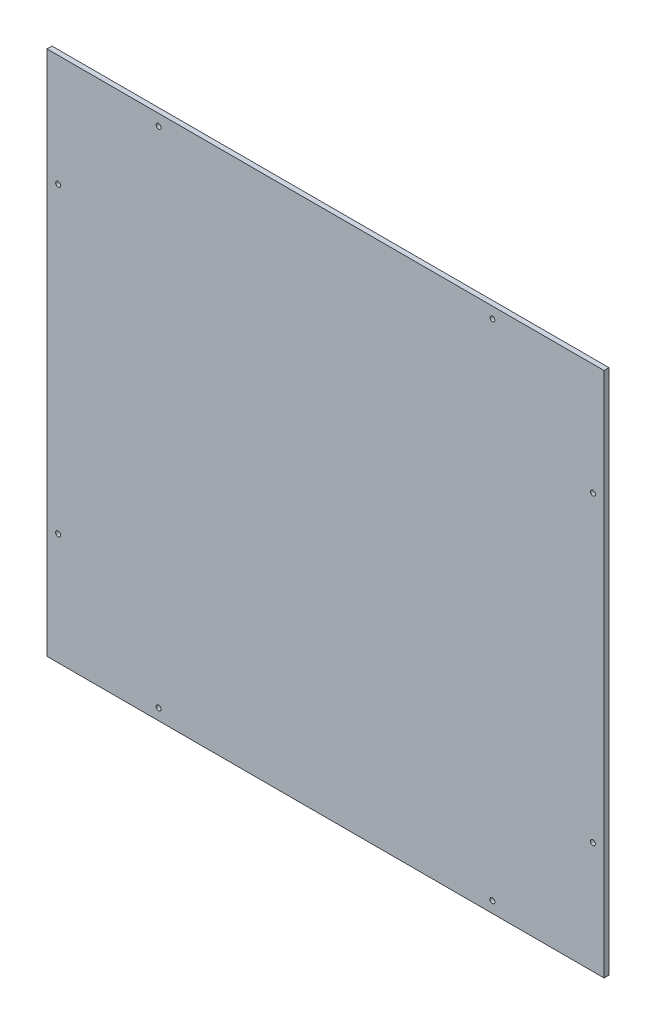
from build123d import *

# Parameters (mm, degrees)
SCHIZZO1_W                   = 449
SCHIZZO1_H                   = 424
SCHIZZO1_R                   = 2
ESTRUSIONE_ESTRUSIONE1_DEPTH = 4


with BuildPart() as part:
    # Schizzo1 → Estrusione-Estrusione1 (new body)
    with BuildSketch(Plane.XY):
        with Locations((-224.5, 212)):
            Rectangle(SCHIZZO1_W, SCHIZZO1_H)
        with Locations((-90, 415)):
            Circle(SCHIZZO1_R, mode=Mode.SUBTRACT)
        with Locations((-9, 334)):
            Circle(SCHIZZO1_R, mode=Mode.SUBTRACT)
        with Locations((-359, 415)):
            Circle(SCHIZZO1_R, mode=Mode.SUBTRACT)
        with Locations((-440, 334)):
            Circle(SCHIZZO1_R, mode=Mode.SUBTRACT)
        with Locations((-359, 9)):
            Circle(SCHIZZO1_R, mode=Mode.SUBTRACT)
        with Locations((-440, 90)):
            Circle(SCHIZZO1_R, mode=Mode.SUBTRACT)
        with Locations((-9, 90)):
            Circle(SCHIZZO1_R, mode=Mode.SUBTRACT)
        with Locations((-90, 9)):
            Circle(SCHIZZO1_R, mode=Mode.SUBTRACT)
    extrude(amount=ESTRUSIONE_ESTRUSIONE1_DEPTH)


solid = part.part
